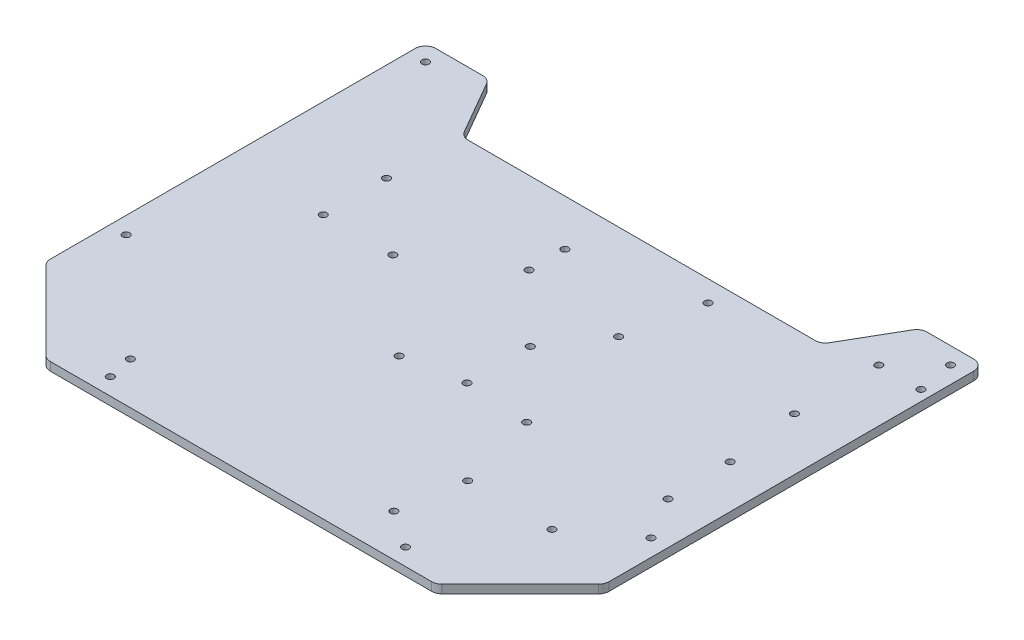
from build123d import *

# Parameters (mm, degrees)
MAIN_EXTRUSION_DEPTH    = 4
CONG_1_R                = 5
ESQUISSE1_R             = 1
ENL_V_MAT_EXTRU_1_DEPTH = 257.850637531
D_GAGEMENT_M31_D        = 3.4
ESQUISSE4_R             = 1
ENL_V_MAT_EXTRU_2_DEPTH = 257.850637531
D_GAGEMENT_M32_D        = 3.4


with BuildPart() as part:
    # Main scetch → Main extrusion (new body)
    with BuildSketch(Plane(origin=(0, 0, 0), x_dir=(1, 0, 0), z_dir=(0, 1, 0))):
        Polygon((-92.5, 0), (92.5, 0), (132.5, 40), (132.5, 220), (102.5, 220), (85.179491924, 190), (-85.179491924, 190), (-102.5, 220), (-132.5, 220), (-132.5, 40), align=None)
    extrude(amount=MAIN_EXTRUSION_DEPTH)

    # Congé1
    cong_1_edges = [part.edges().sort_by_distance(p)[0] for p in [
        (-132.5, 2, -40),
        (-92.5, 2, 0),
        (92.5, 2, 0),
        (132.5, 2, -40),
        (132.5, 2, -220),
        (102.5, 2, -220),
        (85.179491924, 2, -190),
        (-85.179491924, 2, -190),
        (-102.5, 2, -220),
        (-132.5, 2, -220),
    ]]
    fillet(cong_1_edges, radius=CONG_1_R)

    # Esquisse1 → Enlèv. mat.-Extru.1 (cut, through all)
    with BuildSketch(Plane(origin=(0, 4, 0), x_dir=(1, 0, 0), z_dir=(0, 1, 0))):
        with Locations((70, 8)):
            Circle(ESQUISSE1_R)
        with Locations((124.5, 70)):
            Circle(ESQUISSE1_R)
        with Locations((124.5, 212)):
            Circle(ESQUISSE1_R)
        with Locations((-124.5, 212)):
            Circle(ESQUISSE1_R)
        with Locations((-124.5, 70)):
            Circle(ESQUISSE1_R)
        with Locations((-70, 8)):
            Circle(ESQUISSE1_R)
    extrude(amount=-ENL_V_MAT_EXTRU_1_DEPTH, mode=Mode.SUBTRACT)

    # Dégagement M31 (through all)
    with Locations(Plane(origin=(0, 4, 0), x_dir=(1, 0, 0), z_dir=(0, 1, 0))):
        with Locations((-124.5, 212), (-124.5, 70), (-70, 8), (70, 8), (124.5, 70), (124.5, 212)):
            Hole(D_GAGEMENT_M31_D / 2)

    # Esquisse4 → Enlèv. mat.-Extru.2 (cut, through all)
    with BuildSketch(Plane(origin=(0, 4, 0), x_dir=(1, 0, 0), z_dir=(0, 1, 0))):
        with Locations((-86, 125)):
            Circle(ESQUISSE4_R)
        with Locations((-86, 155)):
            Circle(ESQUISSE4_R)
        with Locations((-53, 125)):
            Circle(ESQUISSE4_R)
        with Locations((-14.5, 151.1)):
            Circle(ESQUISSE4_R)
        with Locations((-14.5, 168.1)):
            Circle(ESQUISSE4_R)
        with Locations((41.5, 180)):
            Circle(ESQUISSE4_R)
        with Locations((34.12, 145)):
            Circle(ESQUISSE4_R)
        with Locations((107.5, 155)):
            Circle(ESQUISSE4_R)
        with Locations((127.5, 195)):
            Circle(ESQUISSE4_R)
        with Locations((112, 120)):
            Circle(ESQUISSE4_R)
        with Locations((112.5, 90)):
            Circle(ESQUISSE4_R)
        with Locations((17.2, 120)):
            Circle(ESQUISSE4_R)
        with Locations((17.2, 90)):
            Circle(ESQUISSE4_R)
        with Locations((47.5, 88)):
            Circle(ESQUISSE4_R)
        with Locations((57.5, 50)):
            Circle(ESQUISSE4_R)
        with Locations((97.5, 50)):
            Circle(ESQUISSE4_R)
        with Locations((52.5, 20)):
            Circle(ESQUISSE4_R)
        with Locations((-10, 85)):
            Circle(ESQUISSE4_R)
        with Locations((-72.5, 20)):
            Circle(ESQUISSE4_R)
        with Locations((107.5, 195)):
            Circle(ESQUISSE4_R)
    extrude(amount=-ENL_V_MAT_EXTRU_2_DEPTH, mode=Mode.SUBTRACT)

    # Dégagement M32 (through all)
    with Locations(Plane(origin=(0, 4, 0), x_dir=(1, 0, 0), z_dir=(0, 1, 0))):
        with Locations((-86, 155), (-86, 125), (-53, 125), (17.2, 120), (-14.5, 151.1), (-14.5, 168.1), (34.12, 145), (41.5, 180), (107.5, 155), (127.5, 195), (112, 120), (112.5, 90), (47.5, 88), (17.2, 90), (57.5, 50), (97.5, 50), (-10, 85), (-72.5, 20), (52.5, 20), (107.5, 195)):
            Hole(D_GAGEMENT_M32_D / 2)


solid = part.part
